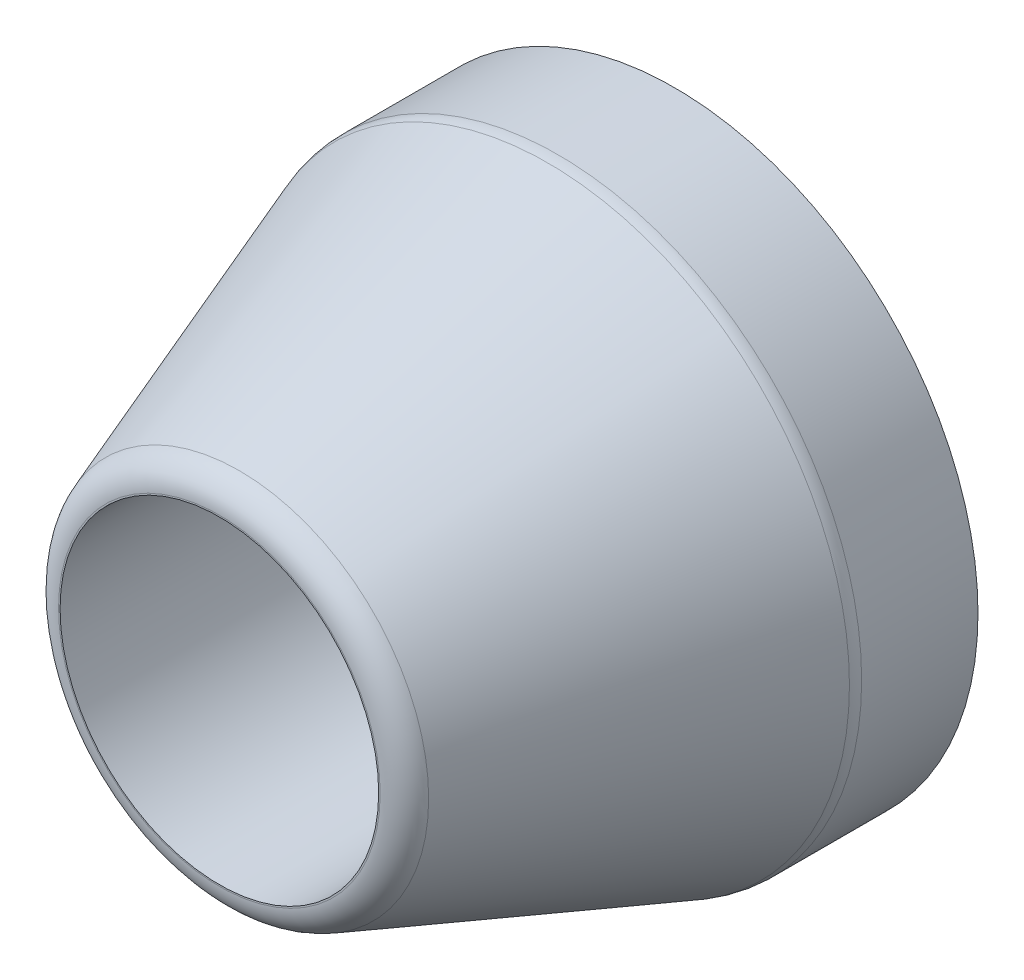
from build123d import *

# Parameters (mm, degrees)
SKETCH1_R           = 10
BOSS_EXTRUDE1_DEPTH = 15
SKETCH2_R           = 2
CUT_EXTRUDE1_DEPTH  = 21.615528128
SKETCH3_R           = 5.25
CUT_EXTRUDE2_DEPTH  = 8
CHAMFER1_SIZE       = 4
CHAMFER1_SIZE2      = 10.989909678
CHAMFER2_SIZE       = 2
FILLET1_R           = 1


with BuildPart() as part:
    # Sketch1 → Boss-Extrude1 (new body)
    with BuildSketch(Plane.XY):
        Circle(SKETCH1_R)
    extrude(amount=BOSS_EXTRUDE1_DEPTH)

    # Sketch2 → Cut-Extrude1 (cut, through all)
    with BuildSketch(Plane.XY.offset(15)):
        Circle(SKETCH2_R)
    extrude(amount=-CUT_EXTRUDE1_DEPTH, mode=Mode.SUBTRACT)

    # Sketch3 → Cut-Extrude2 (cut)
    with BuildSketch(Plane.XY.offset(15)):
        Circle(SKETCH3_R)
    extrude(amount=-CUT_EXTRUDE2_DEPTH, mode=Mode.SUBTRACT)

    # Chamfer1
    chamfer1_edges = [part.edges().sort_by_distance(p)[0] for p in [
        (-10, 0, 15),
    ]]
    chamfer1_side = [part.faces().sort_by_distance(p)[0] for p in [
        (-9.717157288, 0, 15),
    ]]
    chamfer(chamfer1_edges, length=CHAMFER1_SIZE, length2=CHAMFER1_SIZE2, reference=chamfer1_side[0])

    # Chamfer2
    chamfer2_edges = [part.edges().sort_by_distance(p)[0] for p in [
        (-2, 0, 0),
    ]]
    chamfer(chamfer2_edges, length=CHAMFER2_SIZE)

    # Fillet1
    fillet1_edges = [part.edges().sort_by_distance(p)[0] for p in [
        (-6, 0, 15),
        (-10, 0, 4.010090322),
    ]]
    fillet(fillet1_edges, radius=FILLET1_R)


solid = part.part
